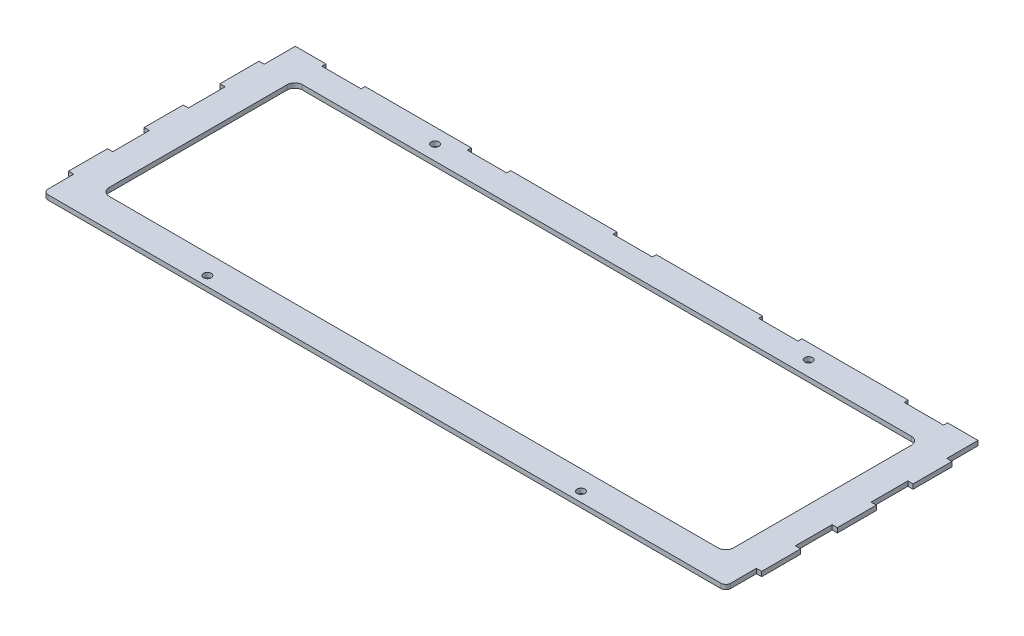
from build123d import *

# Parameters (mm, degrees)
BASE_FLANGE1_DEPTH  = 3
SKETCH7_W           = 25.2
SKETCH7_H           = 2.55
CUT_EXTRUDE1_DEPTH  = 10
SKETCH8_W           = 3
SKETCH8_H           = 25
BOSS_EXTRUDE1_DEPTH = 3
SKETCH9_W           = 0.35
SKETCH9_H           = 20
SKETCH9_H_2         = 23.55
CUT_EXTRUDE2_DEPTH  = 4.55
CUT_EXTRUDE3_START  = -4.55
CUT_EXTRUDE3_DEPTH  = 4.55
SKETCH11_R          = 2.5
CUT_EXTRUDE4_DEPTH  = 238.069747121


# Sheet-metal steps are written as plain solids
with BuildPart() as part:
    # Sketch1 → Base-Flange1 (new body)
    with BuildSketch(Plane(origin=(0, 0, 0), x_dir=(1, 0, 0), z_dir=(0, 1, 0))):
        with BuildLine():
            Line((-219.25, 79.3), (219.25, 79.3))
            Line((219.25, 79.3), (219.25, -79.3))
            ThreePointArc((219.25, -79.3), (218.224873734, -81.774873734), (215.75, -82.8))
            Line((215.75, -82.8), (-215.75, -82.8))
            ThreePointArc((-215.75, -82.8), (-218.224873734, -81.774873734), (-219.25, -79.3))
            Line((-219.25, -79.3), (-219.25, 79.3))
        make_face()
        with BuildLine():
            Line((-195.2, 60.25), (195.2, 60.25))
            ThreePointArc((195.2, 60.25), (198.735533906, 58.785533906), (200.2, 55.25))
            Line((200.2, 55.25), (200.2, -58.75))
            ThreePointArc((200.2, -58.75), (198.735533906, -62.285533906), (195.2, -63.75))
            Line((195.2, -63.75), (-195.2, -63.75))
            ThreePointArc((-195.2, -63.75), (-198.735533906, -62.285533906), (-200.2, -58.75))
            Line((-200.2, -58.75), (-200.2, 55.25))
            ThreePointArc((-200.2, 55.25), (-198.735533906, 58.785533906), (-195.2, 60.25))
        make_face(mode=Mode.SUBTRACT)
    extrude(amount=-BASE_FLANGE1_DEPTH)

    # Sketch7 → Cut-Extrude1 (cut)
    with BuildSketch(Plane.XZ.offset(3)):
        with Locations((186.75, -78.025)):
            Rectangle(SKETCH7_W, SKETCH7_H)
        with Locations((93.375, -78.025)):
            Rectangle(SKETCH7_W, SKETCH7_H)
        with Locations((0, -78.025)):
            Rectangle(SKETCH7_W, SKETCH7_H)
        with Locations((-93.375, -78.025)):
            Rectangle(SKETCH7_W, SKETCH7_H)
        with Locations((-186.75, -78.025)):
            Rectangle(SKETCH7_W, SKETCH7_H)
    extrude(amount=-CUT_EXTRUDE1_DEPTH, mode=Mode.SUBTRACT)

    # Sketch8 → Boss-Extrude1 (add)
    with BuildSketch(Plane.XZ.offset(3)):
        with Locations((-220.75, -46.8)):
            Rectangle(SKETCH8_W, SKETCH8_H)
        with Locations((-220.75, 1.75)):
            Rectangle(SKETCH8_W, SKETCH8_H)
        with Locations((-220.75, 50.3)):
            Rectangle(SKETCH8_W, SKETCH8_H)
    boss_extrude1 = extrude(amount=-BOSS_EXTRUDE1_DEPTH)

    # Sketch9 → Cut-Extrude2 (cut)
    with BuildSketch(Plane.XZ.offset(3)):
        with Locations((-219.075, -69.3)):
            Rectangle(SKETCH9_W, SKETCH9_H)
        with Locations((-219.075, -22.525)):
            Rectangle(SKETCH9_W, SKETCH9_H_2)
        with Locations((-219.075, 26.025)):
            Rectangle(SKETCH9_W, SKETCH9_H_2)
    cut_extrude2 = extrude(amount=-CUT_EXTRUDE2_DEPTH, mode=Mode.SUBTRACT)

    # Mirror1: Boss-Extrude1, Cut-Extrude2 across plane
    add(boss_extrude1.mirror(Plane(origin=(0, 0, 0), x_dir=(0, 0, 1), z_dir=(1, 0, 0))))
    add(cut_extrude2.mirror(Plane(origin=(0, 0, 0), x_dir=(0, 0, 1), z_dir=(1, 0, 0))), mode=Mode.SUBTRACT)

    # Sketch10 → Cut-Extrude3 (cut)
    with BuildSketch(Plane.XZ.offset(3).offset(CUT_EXTRUDE3_START)):
        with BuildLine():
            Line((219.25, 79.3), (219.25, 62.8))
            Line((219.25, 62.8), (218.9, 62.8))
            Line((218.9, 62.8), (218.9, 79.3))
            ThreePointArc((218.9, 79.3), (217.977386361, 81.527386361), (215.75, 82.45))
            Line((215.75, 82.45), (-215.75, 82.45))
            ThreePointArc((-215.75, 82.45), (-217.977386361, 81.527386361), (-218.9, 79.3))
            Line((-218.9, 79.3), (-218.9, 62.8))
            Line((-218.9, 62.8), (-219.25, 62.8))
            Line((-219.25, 62.8), (-219.25, 79.3))
            ThreePointArc((-219.25, 79.3), (-218.224873734, 81.774873734), (-215.75, 82.8))
            Line((-215.75, 82.8), (215.75, 82.8))
            ThreePointArc((215.75, 82.8), (218.224873734, 81.774873734), (219.25, 79.3))
        make_face()
    extrude(amount=CUT_EXTRUDE3_DEPTH, mode=Mode.SUBTRACT)

    # Sketch11 → Cut-Extrude4 (cut, through all)
    with BuildSketch(Plane.XZ.offset(3)):
        with Locations(Location((-119.740950076, 76.275, 0), (0, 0, 270))):
            Circle(SKETCH11_R)
        with Locations(Location((-119.740950076, -69.775, 0), (0, 0, 270))):
            Circle(SKETCH11_R)
        with Locations(Location((119.860899699, -69.775, 0), (0, 0, 270))):
            Circle(SKETCH11_R)
        with Locations(Location((119.860899699, 76.275, 0), (0, 0, 270))):
            Circle(SKETCH11_R)
    extrude(amount=-CUT_EXTRUDE4_DEPTH, mode=Mode.SUBTRACT)


solid = part.part
